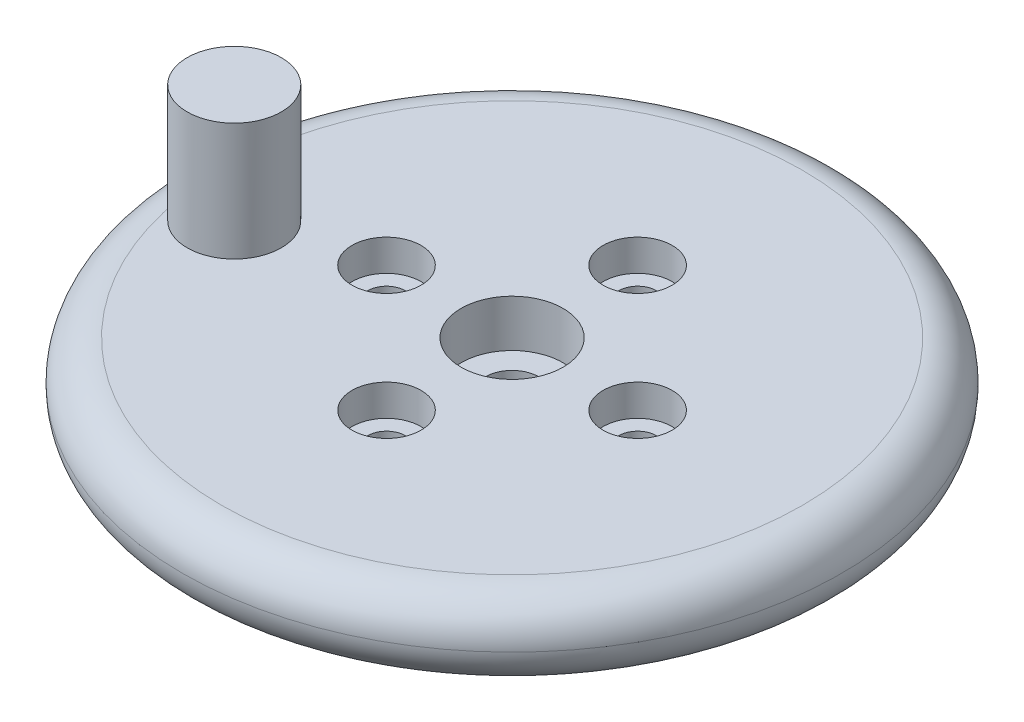
from build123d import *

# Parameters (mm, degrees)
SKETCH1_R                      = 21
BOSS_EXTRUDE1_DEPTH            = 5
FILLET1_R                      = 2.5
SKETCH2_R                      = 3
BOSS_EXTRUDE2_DEPTH            = 7.5
CBORE_FOR_M3_SHCS1_D           = 3.4
CBORE_FOR_M3_SHCS1_CBORE_D     = 6.5
CBORE_FOR_M3_SHCS1_CBORE_DEPTH = 3
CIRPATTERN1_COUNT              = 4


with BuildPart() as part:
    # Sketch1 → Boss-Extrude1 (new body)
    with BuildSketch(Plane(origin=(0, 0, 0), x_dir=(1, 0, 0), z_dir=(0, 1, 0))):
        with Locations(Location((0, 0, 0), (0, 0, 270))):
            Circle(SKETCH1_R)
    extrude(amount=BOSS_EXTRUDE1_DEPTH)

    # Fillet1
    fillet1_edges = [part.edges().sort_by_distance(p)[0] for p in [
        (0, 0, -21),
        (0, 5, -21),
    ]]
    fillet(fillet1_edges, radius=FILLET1_R - 0.0001)  # a hair under: the kernel refuses the full size

    # Sketch2 → Boss-Extrude2 (add)
    with BuildSketch(Plane(origin=(0, 5, 0), x_dir=(1, 0, 0), z_dir=(0, 1, 0))):
        with Locations(Location((-15.314964139, -2.387859588, 0), (0, 0, 188.862019992))):
            Circle(SKETCH2_R)
    extrude(amount=BOSS_EXTRUDE2_DEPTH)

    # CBORE for M3 SHCS1 (through all)
    with Locations(Plane(origin=(0, 5, 0), x_dir=(1, 0, 0), z_dir=(0, 1, 0))):
        with Locations((0, 0)):
            CounterBoreHole(CBORE_FOR_M3_SHCS1_D / 2, CBORE_FOR_M3_SHCS1_CBORE_D / 2, CBORE_FOR_M3_SHCS1_CBORE_DEPTH)

    # Sketch10 → CBORe for M2 (revolve, cut)
    with BuildSketch(Plane.XY, mode=Mode.PRIVATE) as cbore_for_m2_sk:
        Polygon((8, 5), (8, 0), (9.2, 0), (9.2, 3), (10.2, 3), (10.2, 5), align=None)
    cbore_for_m2 = revolve(cbore_for_m2_sk.sketch.rotate(Axis((8, 5, 0), (0, -1, 0)), 90), axis=Axis((8, 5, 0), (0, -1, 0)), mode=Mode.SUBTRACT)

    # CirPattern1: CBORe for M2 ×4 about axis
    cirpattern1_axis = Axis((0, 0, 0), (0, 1, 0))
    for i in range(1, CIRPATTERN1_COUNT):
        add(cbore_for_m2.rotate(cirpattern1_axis, i * 360 / CIRPATTERN1_COUNT), mode=Mode.SUBTRACT)


solid = part.part
